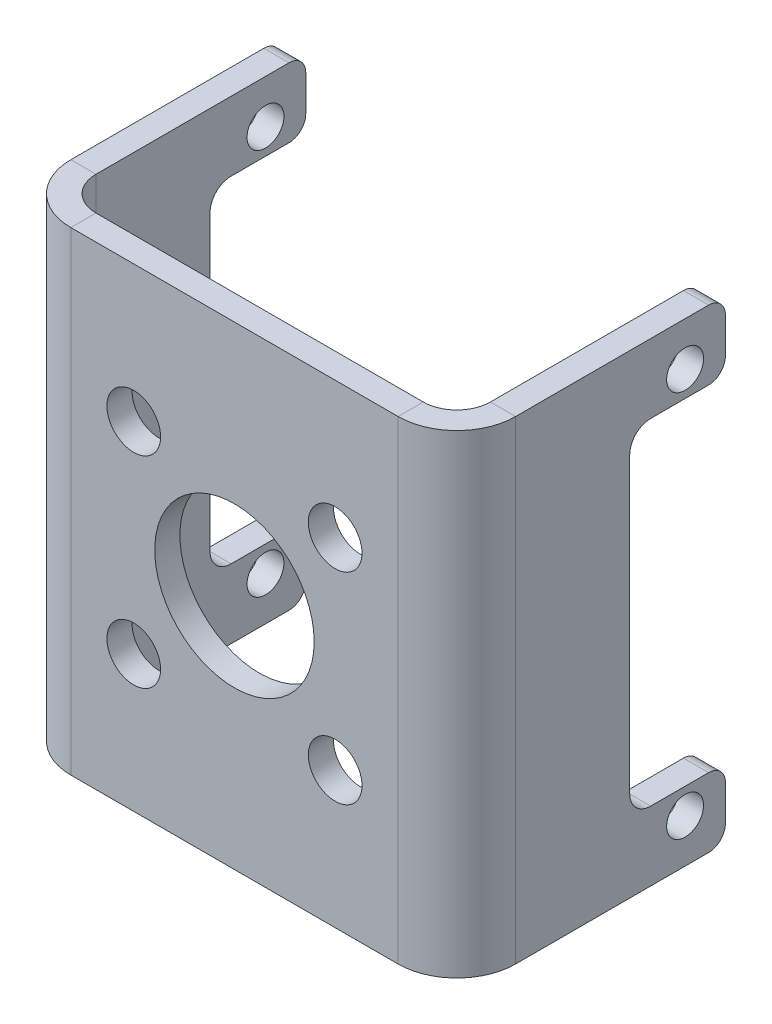
from build123d import *

# Parameters (mm, degrees)
SKETCH1_W                      = 23.5
SKETCH1_H                      = 28.25
BASE_FLANGE1_DEPTH             = 1.5
EDGE_FLANGE1_STRIP_W           = 10
EDGE_FLANGE1_STRIP_H           = 1.5
EDGE_FLANGE1_STRIP_CUT_DEPTH   = 28.25
EDGE_FLANGE1_STRIP_2_W         = 10
EDGE_FLANGE1_STRIP_2_H         = 1.5
EDGE_FLANGE1_STRIP_CUT_2_DEPTH = 28.25
EDGE_FLANGE1_DEPTH             = 28.25
EDGE_FLANGE1_BEND_DEPTH        = 28.25
SKETCH12_R                     = 1.6
SKETCH12_R_2                   = 4.75
CUT_EXTRUDE1_DEPTH             = 26.12126838
SKETCH13_R                     = 1.1
SKETCH13_W                     = 29.65
SKETCH13_H                     = 20
CUT_EXTRUDE2_DEPTH             = 35.025955167
FILLET1_R                      = 1.25
FILLET2_R                      = 1


# Sheet-metal steps are written as plain solids
with BuildPart() as part:
    # Sketch1 → Base-Flange1 (new body)
    with BuildSketch(Plane.XY):
        Rectangle(SKETCH1_W, SKETCH1_H)
    extrude(amount=-BASE_FLANGE1_DEPTH)

    # Edge-Flange1 strip (across the edge) → Edge-Flange1 strip cut (cut)
    with BuildSketch(Plane(origin=(11.75, 14.125, -1.5), x_dir=(-1, 0, 0), z_dir=(0, -1, 0))):
        with Locations((-3, -0.75)):
            Rectangle(EDGE_FLANGE1_STRIP_W, EDGE_FLANGE1_STRIP_H)
    extrude(amount=EDGE_FLANGE1_STRIP_CUT_DEPTH, mode=Mode.SUBTRACT)

    # Edge-Flange1 strip 2 (across the edge) → Edge-Flange1 strip cut 2 (cut)
    with BuildSketch(Plane(origin=(-11.75, -14.125, -1.5), x_dir=(1, 0, 0), z_dir=(0, 1, 0))):
        with Locations((-3, -0.75)):
            Rectangle(EDGE_FLANGE1_STRIP_2_W, EDGE_FLANGE1_STRIP_2_H)
    extrude(amount=EDGE_FLANGE1_STRIP_CUT_2_DEPTH, mode=Mode.SUBTRACT)

    # Edge-Flange1 section (across the edge) → Edge-Flange1 (add)
    with BuildSketch(Plane(origin=(11.75, 14.125, -1.5), x_dir=(-1, 0, 0), z_dir=(0, -1, 0))):
        with BuildLine():
            Line((-1.5, 2), (-1.5, 14.5))
            Line((-1.5, 14.5), (0, 14.5))
            Line((0, 14.5), (0, 2))
            ThreePointArc((0, 2), (0.585786438, 0.585786438), (2, 0))
            Line((2, 0), (2, -1.5))
            ThreePointArc((2, -1.5), (-0.474873734, -0.474873734), (-1.5, 2))
        make_face()
    extrude(amount=EDGE_FLANGE1_DEPTH)

    # Edge-Flange1 section 2 (across the edge) → Edge-Flange1 bend (add)
    with BuildSketch(Plane(origin=(-11.75, -14.125, -1.5), x_dir=(1, 0, 0), z_dir=(0, 1, 0))):
        with BuildLine():
            Line((-1.5, 2), (-1.5, 14.5))
            Line((-1.5, 14.5), (0, 14.5))
            Line((0, 14.5), (0, 2))
            ThreePointArc((0, 2), (0.585786438, 0.585786438), (2, 0))
            Line((2, 0), (2, -1.5))
            ThreePointArc((2, -1.5), (-0.474873734, -0.474873734), (-1.5, 2))
        make_face()
    extrude(amount=EDGE_FLANGE1_BEND_DEPTH)

    # Sketch12 → Cut-Extrude1 (cut, through all)
    with BuildSketch(Plane.XY):
        with Locations((-6, 6)):
            Circle(SKETCH12_R)
        with Locations((6, 6)):
            Circle(SKETCH12_R)
        with Locations((6, -6)):
            Circle(SKETCH12_R)
        with Locations((-6, -6)):
            Circle(SKETCH12_R)
        Circle(SKETCH12_R_2)
    extrude(amount=-CUT_EXTRUDE1_DEPTH, mode=Mode.SUBTRACT)

    # Sketch13 → Cut-Extrude2 (cut, through all)
    with BuildSketch(Plane(origin=(13.25, 0, 0), x_dir=(0, 0, -1), z_dir=(1, 0, 0))):
        with Locations((13.6, 11.525)):
            Circle(SKETCH13_R)
        with Locations((13.6, -11.525)):
            Circle(SKETCH13_R)
        with Locations((25.125, 0)):
            Rectangle(SKETCH13_W, SKETCH13_H)
    extrude(amount=-CUT_EXTRUDE2_DEPTH, mode=Mode.SUBTRACT)

    # Fillet1
    fillet1_edges = [part.edges().sort_by_distance(p)[0] for p in [
        (12.5, -10, -10.3),
        (12.5, 10, -10.3),
        (-12.5, -10, -10.3),
        (-12.5, 10, -10.3),
    ]]
    fillet(fillet1_edges, radius=FILLET1_R)

    # Fillet2
    fillet2_edges = [part.edges().sort_by_distance(p)[0] for p in [
        (-12.5, 10, -16),
        (-12.5, -10, -16),
        (12.5, -10, -16),
        (12.5, 10, -16),
        (12.5, 14.125, -16),
        (12.5, -14.125, -16),
        (-12.5, -14.125, -16),
        (-12.5, 14.125, -16),
    ]]
    fillet(fillet2_edges, radius=FILLET2_R)


solid = part.part
